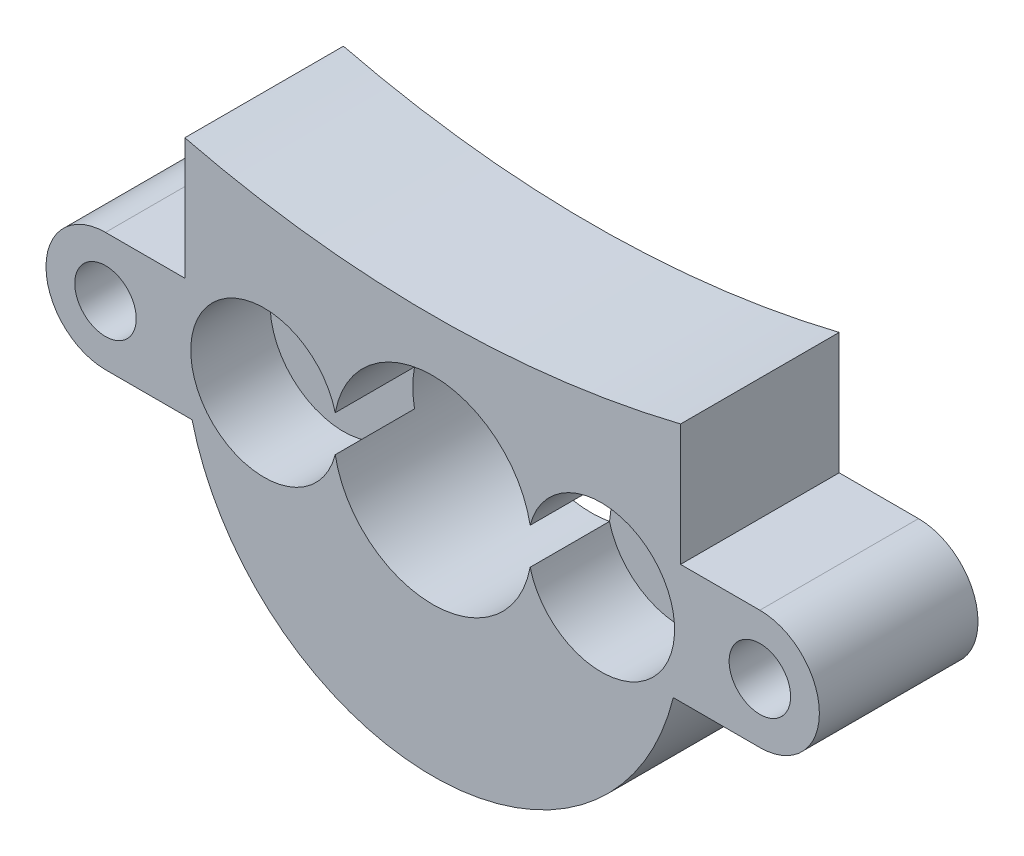
from build123d import *

# Parameters (mm, degrees)
SKETCH1_R           = 1.55
SKETCH1_R_2         = 5
BOSS_EXTRUDE1_DEPTH = 8
SKETCH2_R           = 3.7
CUT_EXTRUDE1_DEPTH  = 4


with BuildPart() as part:
    # Sketch1 → Boss-Extrude1 (new body)
    with BuildSketch(Plane.XY):
        with BuildLine():
            Line((-16.5, 3), (-12.5, 3))
            Line((-12.5, 3), (-12.5, 9.132525127))
            ThreePointArc((-12.5, 9.132525127), (0, 7.619182901), (12.5, 9.132525127))
            Line((12.5, 9.132525127), (12.5, 3))
            Line((12.5, 3), (16.5, 3))
            ThreePointArc((16.5, 3), (19.5, 0), (16.5, -3))
            Line((16.5, -3), (12.1346611, -3))
            ThreePointArc((12.1346611, -3), (0, -12.5), (-12.1346611, -3))
            Line((-12.1346611, -3), (-16.5, -3))
            ThreePointArc((-16.5, -3), (-19.5, 0), (-16.5, 3))
        make_face()
        with Locations((-8.5, 0)):
            Circle(SKETCH1_R, mode=Mode.SUBTRACT)
        with Locations((8.5, 0)):
            Circle(SKETCH1_R, mode=Mode.SUBTRACT)
        Circle(SKETCH1_R_2, mode=Mode.SUBTRACT)
        with Locations((-16.5, 0)):
            Circle(SKETCH1_R, mode=Mode.SUBTRACT)
        with Locations((16.5, 0)):
            Circle(SKETCH1_R, mode=Mode.SUBTRACT)
    extrude(amount=BOSS_EXTRUDE1_DEPTH)

    # Sketch2 → Cut-Extrude1 (cut)
    with BuildSketch(Plane.XY.offset(8)):
        with Locations((-8.5, 0)):
            Circle(SKETCH2_R)
        with Locations((8.5, 0)):
            Circle(SKETCH2_R)
    extrude(amount=-CUT_EXTRUDE1_DEPTH, mode=Mode.SUBTRACT)


solid = part.part
